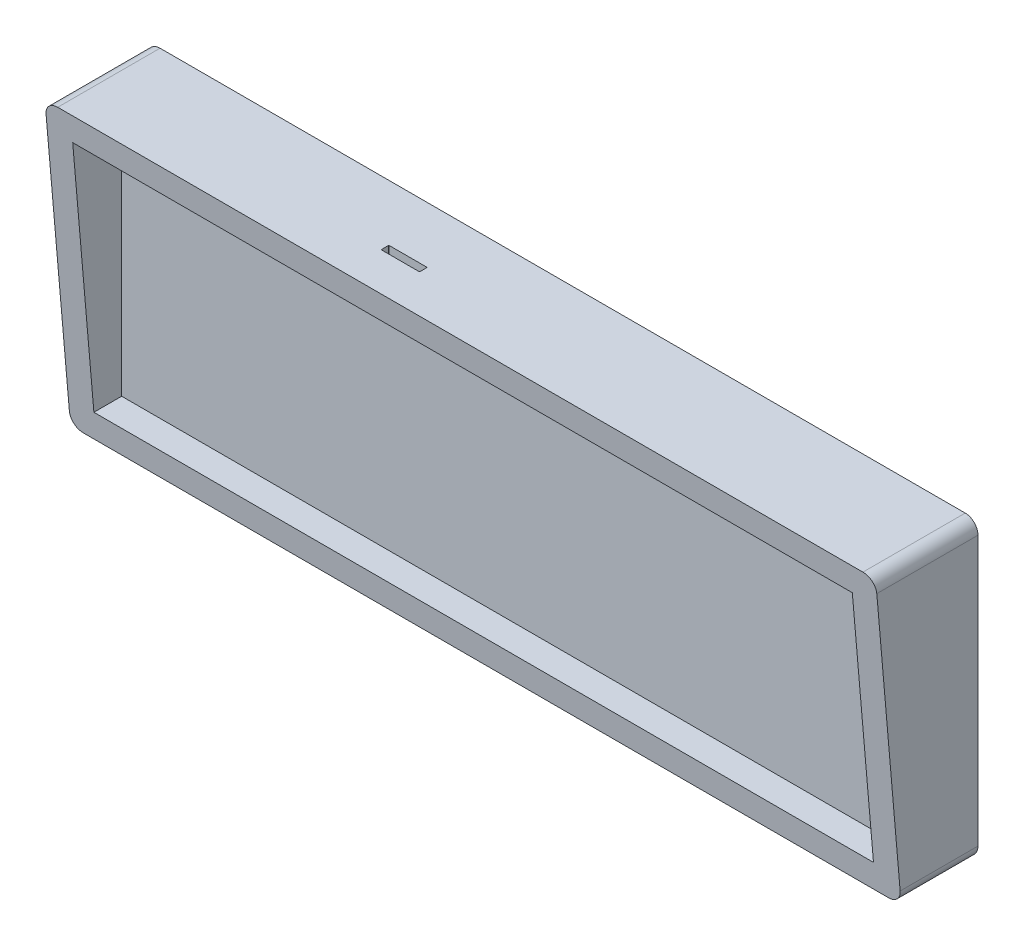
from build123d import *

# Parameters (mm, degrees)
SKETCH2_W           = 324.8
SKETCH2_H           = 115.25
BOSS_EXTRUDE1_DEPTH = 40
SKETCH3_W           = 304.8
SKETCH3_H           = 95.45
CUT_EXTRUDE1_DEPTH  = 20
CUT_EXTRUDE2_DEPTH  = 324.8
SKETCH5_W           = 15
SKETCH5_H           = 3
CUT_EXTRUDE6_DEPTH  = 50
FILLET2_R           = 5
FILLET3_R           = 0.1
FILLET4_R           = 0.1
FILLET5_R           = 0.1
FILLET6_R           = 0.1


with BuildPart() as part:
    # Sketch2 → Boss-Extrude1 (new body)
    with BuildSketch(Plane.XY):
        Rectangle(SKETCH2_W, SKETCH2_H)
    extrude(amount=BOSS_EXTRUDE1_DEPTH)

    # Sketch3 → Cut-Extrude1 (cut)
    with BuildSketch(Plane.XY.offset(40)):
        Rectangle(SKETCH3_W, SKETCH3_H)
    extrude(amount=-CUT_EXTRUDE1_DEPTH, mode=Mode.SUBTRACT)

    # Sketch4 → Cut-Extrude2 (cut)
    with BuildSketch(Plane.ZY.offset(162.4)):
        Polygon((30, -57.625), (40, 57.625), (40, -57.625), align=None)
    extrude(amount=-CUT_EXTRUDE2_DEPTH, mode=Mode.SUBTRACT)

    # Sketch5 → Cut-Extrude6 (cut)
    with BuildSketch(Plane(origin=(0, 57.625, 0), x_dir=(1, 0, 0), z_dir=(0, 1, 0))):
        with Locations((-38.45, -23.5)):
            Rectangle(SKETCH5_W, SKETCH5_H)
    extrude(amount=-CUT_EXTRUDE6_DEPTH, mode=Mode.SUBTRACT)

    # Fillet2
    fillet2_edges = [part.edges().sort_by_distance(p)[0] for p in [
        (162.4, -57.625, 15),
        (162.4, 57.625, 20),
        (-162.4, -57.625, 15),
        (-162.4, 57.625, 20),
    ]]
    fillet(fillet2_edges, radius=FILLET2_R)

    # Fillet3
    fillet3_edges = [part.edges().sort_by_distance(p)[0] for p in [
        (-45.95, 52.675, 25),
    ]]
    fillet(fillet3_edges, radius=FILLET3_R)

    # Fillet4
    fillet4_edges = [part.edges().sort_by_distance(p)[0] for p in [
        (-30.95, 52.675, 22),
    ]]
    fillet(fillet4_edges, radius=FILLET4_R)

    # Fillet5
    fillet5_edges = [part.edges().sort_by_distance(p)[0] for p in [
        (-30.95, 52.675, 25),
    ]]
    fillet(fillet5_edges, radius=FILLET5_R)

    # Fillet6
    fillet6_edges = [part.edges().sort_by_distance(p)[0] for p in [
        (-45.95, 52.675, 22),
    ]]
    fillet(fillet6_edges, radius=FILLET6_R)


solid = part.part
